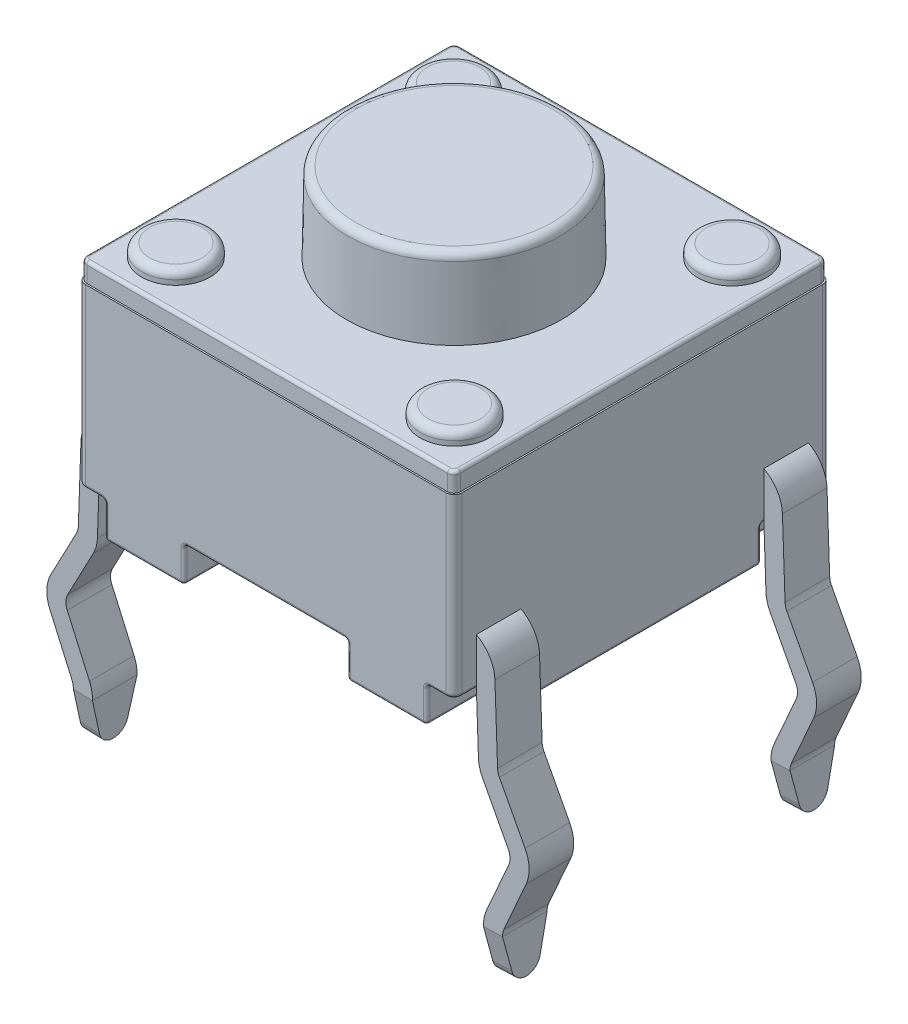
from build123d import *

# Parameters (mm, degrees)
BOSS_EXTRUDE1_START  = 0.5588
SKETCH1_W            = 6.0071
SKETCH1_H            = 6.0071
BOSS_EXTRUDE1_DEPTH  = 2.8194
FILLET1_R            = 0.127
BOSS_EXTRUDE2_DEPTH  = 0.3048
BOSS_EXTRUDE3_REACH  = 7.622
SKETCH4_R            = 0.5461
BOSS_EXTRUDE4_DEPTH  = 0.2032
SKETCH5_R            = 1.7145
BOSS_EXTRUDE5_DEPTH  = 1.27
BOSS_EXTRUDE5_TAPER  = 1
FILLET2_R            = 0.127
FILLET3_R            = 0.0508
EXTRUDE_THIN1_START  = -0.3556
EXTRUDE_THIN1_DEPTH  = 0.7112
CUT_EXTRUDE1_DEPTH   = 0.7112
MIRROR3_START        = -0.3556
MIRROR3_COPY_1_DEPTH = 0.7112
MIRROR3_COPY_2_DEPTH = 0.7112


with BuildPart() as part:
    # Sketch1 → Boss-Extrude1 (new body)
    with BuildSketch(Plane(origin=(0, 0, 0), x_dir=(1, 0, 0), z_dir=(0, 1, 0)).offset(BOSS_EXTRUDE1_START)):
        Rectangle(SKETCH1_W, SKETCH1_H)
    extrude(amount=BOSS_EXTRUDE1_DEPTH)

    # Fillet1
    fillet1_edges = [part.edges().sort_by_distance(p)[0] for p in [
        (3.00355, 1.9685, 3.00355),
        (-3.00355, 1.9685, 3.00355),
        (-3.00355, 1.9685, -3.00355),
        (3.00355, 1.9685, -3.00355),
    ]]
    fillet(fillet1_edges, radius=FILLET1_R)

    # Sketch2 → Boss-Extrude2 (add)
    with BuildSketch(Plane(origin=(0, 3.3782, 0), x_dir=(-1, 0, 0), z_dir=(0, -1, 0))):
        with BuildLine():
            Line((2.97815, -2.87655), (2.97815, 2.87655))
            ThreePointArc((2.97815, 2.87655), (2.948392049, 2.948392049), (2.87655, 2.97815))
            Line((2.87655, 2.97815), (-2.87655, 2.97815))
            ThreePointArc((-2.87655, 2.97815), (-2.948392049, 2.948392049), (-2.97815, 2.87655))
            Line((-2.97815, 2.87655), (-2.97815, -2.87655))
            ThreePointArc((-2.97815, -2.87655), (-2.948392049, -2.948392049), (-2.87655, -2.97815))
            Line((-2.87655, -2.97815), (2.87655, -2.97815))
            ThreePointArc((2.87655, -2.97815), (2.948392049, -2.948392049), (2.97815, -2.87655))
        make_face()
    extrude(amount=-BOSS_EXTRUDE2_DEPTH)

    # Sketch3 → Boss-Extrude3 (add, up to next)
    with BuildSketch(Plane(origin=(0, 0, 0), x_dir=(1, 0, 0), z_dir=(0, 1, 0)), mode=Mode.PRIVATE) as boss_extrude3_sk1:
        Polygon((-2.566197678, -3.00355), (-2.566197678, -1.89483443), (-3.00355, -1.89483443), (-3.00355, 1.89483443), (-2.566197678, 1.89483443), (-2.566197678, 3.00355), (-1.30175, 3.00355), (-1.30175, 0.560941661), (-2.441300776, 0.560941661), (-2.441300776, -0.560941661), (-1.30175, -0.560941661), (-1.30175, -3.00355), align=None)
    boss_extrude3_tool1 = extrude(boss_extrude3_sk1.sketch, amount=BOSS_EXTRUDE3_REACH, mode=Mode.PRIVATE) - part.part
    # Sketch3 → Boss-Extrude3 (add, up to next)
    with BuildSketch(Plane(origin=(0, 0, 0), x_dir=(1, 0, 0), z_dir=(0, 1, 0)), mode=Mode.PRIVATE) as boss_extrude3_sk2:
        Polygon((2.566197678, 3.00355), (2.566197678, 1.89483443), (3.00355, 1.89483443), (3.00355, -1.89483443), (2.566197678, -1.89483443), (2.566197678, -3.00355), (1.30175, -3.00355), (1.30175, -0.560941661), (2.441300776, -0.560941661), (2.441300776, 0.560941661), (1.30175, 0.560941661), (1.30175, 3.00355), align=None)
    boss_extrude3_tool2 = extrude(boss_extrude3_sk2.sketch, amount=BOSS_EXTRUDE3_REACH, mode=Mode.PRIVATE) - part.part
    add(boss_extrude3_tool1.solids().sort_by_distance((-2.503763, 0, 2.449192))[0])
    add(boss_extrude3_tool2.solids().sort_by_distance((2.503763, 0, -2.449192))[0])

    # Sketch4 → Boss-Extrude4 (add)
    with BuildSketch(Plane(origin=(0, 3.683, 0), x_dir=(1, 0, 0), z_dir=(0, 1, 0))):
        with Locations(Location((2.221694311, 2.212885437, 0), (0, 0, 90))):
            Circle(SKETCH4_R)
        with Locations(Location((-2.221694311, 2.212885437, 0), (0, 0, 90))):
            Circle(SKETCH4_R)
        with Locations(Location((-2.221694311, -2.212885437, 0), (0, 0, 90))):
            Circle(SKETCH4_R)
        with Locations(Location((2.221694311, -2.212885437, 0), (0, 0, 90))):
            Circle(SKETCH4_R)
    extrude(amount=BOSS_EXTRUDE4_DEPTH)

    # Sketch5 → Boss-Extrude5 (add)
    with BuildSketch(Plane(origin=(0, 3.683, 0), x_dir=(1, 0, 0), z_dir=(0, 1, 0))):
        Circle(SKETCH5_R)
    extrude(amount=BOSS_EXTRUDE5_DEPTH, taper=BOSS_EXTRUDE5_TAPER)

    # Fillet2
    fillet2_edges = [part.edges().sort_by_distance(p)[0] for p in [
        (2.221694311, 3.8862, -1.666785437),
        (-2.221694311, 3.8862, -1.666785437),
        (-2.221694311, 3.8862, 2.758985437),
        (2.221694311, 3.8862, 2.758985437),
        (-1.692332068, 4.953, 0),
    ]]
    fillet(fillet2_edges, radius=FILLET2_R)

    # Fillet3
    fillet3_edges = [part.edges().sort_by_distance(p)[0] for p in [
        (1.30175, 0.5588, -1.782245831),
        (1.30175, 0.2794, -3.00355),
        (1.30175, 0, -1.782245831),
        (1.871525388, 0.5588, -0.560941661),
        (1.30175, 0.2794, -0.560941661),
        (1.871525388, 0, -0.560941661),
        (2.441300776, 0.5588, 0),
        (2.441300776, 0.2794, -0.560941661),
        (2.441300776, 0, 0),
        (1.871525388, 0.5588, 0.560941661),
        (2.441300776, 0.2794, 0.560941661),
        (1.871525388, 0, 0.560941661),
        (1.30175, 0.5588, 1.782245831),
        (1.30175, 0.2794, 0.560941661),
        (1.30175, 0, 1.782245831),
        (1.30175, 0.2794, 3.00355),
        (1.933973839, 0, 3.00355),
        (2.566197678, 0.5588, 2.449192215),
        (2.566197678, 0.2794, 3.00355),
        (2.566197678, 0, 2.449192215),
        (2.784873839, 0.5588, 1.89483443),
        (2.566197678, 0.2794, 1.89483443),
        (2.784873839, 0, 1.89483443),
        (3.00355, 0.2794, 1.89483443),
        (3.00355, 0, 0),
        (2.784873839, 0.5588, -1.89483443),
        (3.00355, 0.2794, -1.89483443),
        (2.784873839, 0, -1.89483443),
        (2.566197678, 0.2794, -3.00355),
        (1.933973839, 0, -3.00355),
        (2.566197678, 0.5588, -2.449192215),
        (2.566197678, 0.2794, -1.89483443),
        (2.566197678, 0, -2.449192215),
        (-2.721373839, 0.5588, 3.00355),
        (3.00355, 0.5588, 2.385692215),
        (-3.00355, 0.5588, -2.385692215),
        (2.721373839, 0.5588, -3.00355),
        (2.966352561, 0.5588, 2.966352561),
        (2.966352561, 0.5588, -2.966352561),
        (-2.966352561, 0.5588, -2.966352561),
        (-2.966352561, 0.5588, 2.966352561),
        (-2.948392049, 3.683, 2.948392049),
        (0, 3.683, 2.97815),
        (2.948392049, 3.683, 2.948392049),
        (2.97815, 3.683, 0),
        (2.948392049, 3.683, -2.948392049),
        (0, 3.683, -2.97815),
        (-2.948392049, 3.683, -2.948392049),
        (-2.97815, 3.683, 0),
        (0, 0.5588, 3.00355),
        (-3.00355, 0.5588, 2.385692215),
        (-2.721373839, 0.5588, -3.00355),
        (-1.30175, 0.5588, 1.782245831),
        (-1.30175, 0.2794, 3.00355),
        (-1.30175, 0, 1.782245831),
        (-1.871525388, 0.5588, 0.560941661),
        (-1.30175, 0.2794, 0.560941661),
        (-1.871525388, 0, 0.560941661),
        (-2.441300776, 0.5588, 0),
        (-2.441300776, 0.2794, 0.560941661),
        (-2.441300776, 0, 0),
        (-1.871525388, 0.5588, -0.560941661),
        (-2.441300776, 0.2794, -0.560941661),
        (-1.871525388, 0, -0.560941661),
        (-1.30175, 0.5588, -1.782245831),
        (-1.30175, 0.2794, -0.560941661),
        (-1.30175, 0, -1.782245831),
        (-1.30175, 0.2794, -3.00355),
        (-1.933973839, 0, -3.00355),
        (-2.566197678, 0.5588, -2.449192215),
        (-2.566197678, 0.2794, -3.00355),
        (-2.566197678, 0, -2.449192215),
        (-2.784873839, 0.5588, -1.89483443),
        (-2.566197678, 0.2794, -1.89483443),
        (-2.784873839, 0, -1.89483443),
        (-3.00355, 0.2794, -1.89483443),
        (-3.00355, 0, 0),
        (-2.784873839, 0.5588, 1.89483443),
        (-3.00355, 0.2794, 1.89483443),
        (-2.784873839, 0, 1.89483443),
        (-2.566197678, 0.2794, 3.00355),
        (-1.933973839, 0, 3.00355),
        (-2.566197678, 0.5588, 2.449192215),
        (-2.566197678, 0.2794, 1.89483443),
        (-2.566197678, 0, 2.449192215),
        (0, 0.5588, -3.00355),
        (3.00355, 0.5588, -2.385692215),
        (2.721373839, 0.5588, 3.00355),
    ]]
    fillet(fillet3_edges, radius=FILLET3_R)

    # Sketch6 → Extrude-Thin1 (add)
    with BuildSketch(Plane.XY.offset(3.00355).offset(EXTRUDE_THIN1_START)):
        with BuildLine():
            Line((-2.526489479, 1.064092226), (-2.74199854, 1.064092226))
            ThreePointArc((-2.74199854, 1.064092226), (-2.918441767, 0.992804535), (-2.995843811, 0.818956698))
            Line((-2.995843811, 0.818956698), (-3.03780929, -0.382777412))
            ThreePointArc((-3.03780929, -0.382777412), (-3.056264298, -0.506985303), (-3.10198813, -0.623936226))
            Line((-3.10198813, -0.623936226), (-3.511410555, -1.400308198))
            ThreePointArc((-3.511410555, -1.400308198), (-3.540582755, -1.509925841), (-3.519128157, -1.62131141))
            Line((-3.519128157, -1.62131141), (-3.164860036, -2.424352043))
            ThreePointArc((-3.164860036, -2.424352043), (-3.127405669, -2.544207613), (-3.117659921, -2.669400296))
            Line((-3.117659921, -2.669400296), (-3.142411752, -3.3782))
            Line((-3.142411752, -3.3782), (-3.447026076, -3.367562633))
            Line((-3.447026076, -3.367562633), (-3.422274245, -2.658762929))
            ThreePointArc((-3.422274245, -2.658762929), (-3.42670413, -2.601857165), (-3.443728843, -2.54737736))
            Line((-3.443728843, -2.54737736), (-3.797996964, -1.744336727))
            ThreePointArc((-3.797996964, -1.744336727), (-3.845197079, -1.499288474), (-3.781018239, -1.25812966))
            Line((-3.781018239, -1.25812966), (-3.371595814, -0.481757688))
            ThreePointArc((-3.371595814, -0.481757688), (-3.350812254, -0.428598178), (-3.342423614, -0.372140046))
            Line((-3.342423614, -0.372140046), (-3.300458135, 0.829594065))
            ThreePointArc((-3.300458135, 0.829594065), (-3.130173638, 1.212059307), (-2.74199854, 1.368892226))
            Line((-2.74199854, 1.368892226), (-2.526489479, 1.368892226))
            Line((-2.526489479, 1.368892226), (-2.526489479, 1.064092226))
        make_face()
    extrude_thin1 = extrude(amount=-EXTRUDE_THIN1_DEPTH)

    # Sketch9 → Cut-Extrude1 (cut)
    with BuildSketch(Plane(origin=(-3.325373038, 0.116124585, 0), x_dir=(0, 0, 1), z_dir=(-0.9993908270190955, 0.034899496702504834, 0))):
        with BuildLine():
            Line((2.64795, -3.48581068), (2.64795, -2.776578932))
            Line((2.64795, -2.776578932), (2.517535772, -3.30911696))
            ThreePointArc((2.517535772, -3.30911696), (2.435466476, -3.436364343), (2.29235, -3.48581068))
            Line((2.29235, -3.48581068), (2.64795, -3.48581068))
        make_face()
        with BuildLine():
            Line((1.93675, -3.48581068), (2.29235, -3.48581068))
            ThreePointArc((2.29235, -3.48581068), (2.149233524, -3.436364343), (2.067164228, -3.30911696))
            Line((2.067164228, -3.30911696), (1.93675, -2.776578932))
            Line((1.93675, -2.776578932), (1.93675, -3.48581068))
        make_face()
    cut_extrude1 = extrude(amount=-CUT_EXTRUDE1_DEPTH, mode=Mode.SUBTRACT)

    # Mirror1: Extrude-Thin1, Cut-Extrude1 across plane
    add(extrude_thin1.mirror(Plane.XY))
    add(cut_extrude1.mirror(Plane.XY), mode=Mode.SUBTRACT)

    # Mirror3: Extrude-Thin1, Cut-Extrude1 across plane
    add(extrude_thin1.mirror(Plane(origin=(0, 0, 0), x_dir=(0, 0, 1), z_dir=(1, 0, 0))))
    add(cut_extrude1.mirror(Plane(origin=(0, 0, 0), x_dir=(0, 0, 1), z_dir=(1, 0, 0))), mode=Mode.SUBTRACT)

    # Mirror3 copy 1 sketch → Mirror3 copy 1 (add)
    with BuildSketch(Plane(origin=(0, 0, -3.00355), x_dir=(-1, 0, 0), z_dir=(0, 0, -1)).offset(MIRROR3_START)):
        with BuildLine():
            Line((-2.526489479, 1.064092226), (-2.74199854, 1.064092226))
            ThreePointArc((-2.74199854, 1.064092226), (-2.918441767, 0.992804535), (-2.995843811, 0.818956698))
            Line((-2.995843811, 0.818956698), (-3.03780929, -0.382777412))
            ThreePointArc((-3.03780929, -0.382777412), (-3.056264298, -0.506985303), (-3.10198813, -0.623936226))
            Line((-3.10198813, -0.623936226), (-3.511410555, -1.400308198))
            ThreePointArc((-3.511410555, -1.400308198), (-3.540582755, -1.509925841), (-3.519128157, -1.62131141))
            Line((-3.519128157, -1.62131141), (-3.164860036, -2.424352043))
            ThreePointArc((-3.164860036, -2.424352043), (-3.127405669, -2.544207613), (-3.117659921, -2.669400296))
            Line((-3.117659921, -2.669400296), (-3.142411752, -3.3782))
            Line((-3.142411752, -3.3782), (-3.447026076, -3.367562633))
            Line((-3.447026076, -3.367562633), (-3.422274245, -2.658762929))
            ThreePointArc((-3.422274245, -2.658762929), (-3.42670413, -2.601857165), (-3.443728843, -2.54737736))
            Line((-3.443728843, -2.54737736), (-3.797996964, -1.744336727))
            ThreePointArc((-3.797996964, -1.744336727), (-3.845197079, -1.499288474), (-3.781018239, -1.25812966))
            Line((-3.781018239, -1.25812966), (-3.371595814, -0.481757688))
            ThreePointArc((-3.371595814, -0.481757688), (-3.350812254, -0.428598178), (-3.342423614, -0.372140046))
            Line((-3.342423614, -0.372140046), (-3.300458135, 0.829594065))
            ThreePointArc((-3.300458135, 0.829594065), (-3.130173638, 1.212059307), (-2.74199854, 1.368892226))
            Line((-2.74199854, 1.368892226), (-2.526489479, 1.368892226))
            Line((-2.526489479, 1.368892226), (-2.526489479, 1.064092226))
        make_face()
    extrude(amount=-MIRROR3_COPY_1_DEPTH)

    # Mirror3 copy 2 sketch → Mirror3 copy 2 (cut)
    with BuildSketch(Plane(origin=(3.325373038, 0.116124585, 0), x_dir=(0, 0, -1), z_dir=(0.9993908270190955, 0.034899496702504834, 0))):
        with BuildLine():
            Line((2.64795, -3.48581068), (2.64795, -2.776578932))
            Line((2.64795, -2.776578932), (2.517535772, -3.30911696))
            ThreePointArc((2.517535772, -3.30911696), (2.435466476, -3.436364343), (2.29235, -3.48581068))
            Line((2.29235, -3.48581068), (2.64795, -3.48581068))
        make_face()
        with BuildLine():
            Line((1.93675, -3.48581068), (2.29235, -3.48581068))
            ThreePointArc((2.29235, -3.48581068), (2.149233524, -3.436364343), (2.067164228, -3.30911696))
            Line((2.067164228, -3.30911696), (1.93675, -2.776578932))
            Line((1.93675, -2.776578932), (1.93675, -3.48581068))
        make_face()
    extrude(amount=-MIRROR3_COPY_2_DEPTH, mode=Mode.SUBTRACT)


solid = part.part
